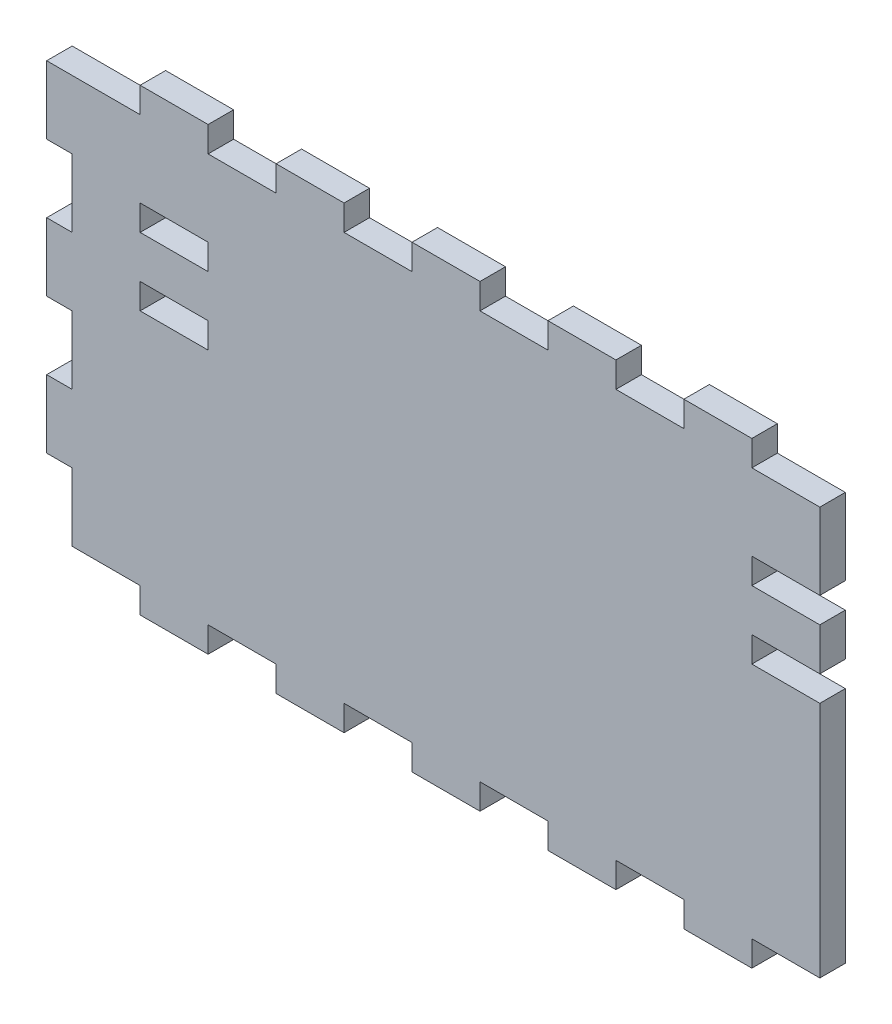
from build123d import *

# Parameters (mm, degrees)
SKETCH1_W               = 279.4
SKETCH1_H               = 152.4
BOSS_EXTRUDE1_DEPTH     = 9.525
SKETCH2_W               = 25.4
SKETCH2_H               = 9.525
BOSS_EXTRUDE2_DEPTH     = 9.525
LPATTERN1_COUNT         = 5
LPATTERN1_PITCH         = 50.8
MIRROR1_COPY_1_SKETCH_W = 25.4
MIRROR1_COPY_1_SKETCH_H = 9.525
MIRROR1_COPY_1_DEPTH    = 9.525
MIRROR1_COPY_2_SKETCH_W = 25.4
MIRROR1_COPY_2_SKETCH_H = 9.525
MIRROR1_COPY_2_DEPTH    = 9.525
MIRROR1_COPY_3_SKETCH_W = 25.4
MIRROR1_COPY_3_SKETCH_H = 9.525
MIRROR1_COPY_3_DEPTH    = 9.525
MIRROR1_COPY_4_SKETCH_W = 25.4
MIRROR1_COPY_4_SKETCH_H = 9.525
MIRROR1_COPY_4_DEPTH    = 9.525
MIRROR1_COPY_5_SKETCH_W = 25.4
MIRROR1_COPY_5_SKETCH_H = 9.525
MIRROR1_COPY_5_DEPTH    = 9.525
SKETCH3_W               = 9.525
SKETCH3_H               = 25.4
BOSS_EXTRUDE3_DEPTH     = 9.525
LPATTERN2_COUNT         = 3
LPATTERN2_PITCH         = 50.8
SKETCH4_W               = 25.4
SKETCH4_H               = 9.525
CUT_EXTRUDE1_DEPTH      = 173.358933261
LPATTERN3_COUNT         = 2
LPATTERN3_PITCH         = 228.6
SKETCH5_W               = 25.4
SKETCH5_H               = 9.525
CUT_EXTRUDE2_DEPTH      = 173.358933261
LPATTERN4_COUNT         = 2
LPATTERN4_PITCH         = 228.6


with BuildPart() as part:
    # Sketch1 → Boss-Extrude1 (new body)
    with BuildSketch(Plane.XY):
        Rectangle(SKETCH1_W, SKETCH1_H)
    extrude(amount=BOSS_EXTRUDE1_DEPTH)

    # Sketch2 → Boss-Extrude2 (add)
    with BuildSketch(Plane.XZ.offset(76.2)):
        with Locations((-101.6, 4.7625)):
            Rectangle(SKETCH2_W, SKETCH2_H)
    boss_extrude2 = extrude(amount=BOSS_EXTRUDE2_DEPTH)

    # LPattern1: Boss-Extrude2 ×5
    with Locations(*[(i * LPATTERN1_PITCH, 0, 0) for i in range(1, LPATTERN1_COUNT)]):
        add(boss_extrude2)

    # Mirror1 copy 1 sketch → Mirror1 copy 1 (add)
    with BuildSketch(Plane(origin=(50.8, 76.2, 0), x_dir=(1, 0, 0), z_dir=(0, 1, 0))):
        with Locations((-101.6, -4.7625)):
            Rectangle(MIRROR1_COPY_1_SKETCH_W, MIRROR1_COPY_1_SKETCH_H)
    extrude(amount=MIRROR1_COPY_1_DEPTH)

    # Mirror1 copy 2 sketch → Mirror1 copy 2 (add)
    with BuildSketch(Plane(origin=(101.6, 76.2, 0), x_dir=(1, 0, 0), z_dir=(0, 1, 0))):
        with Locations((-101.6, -4.7625)):
            Rectangle(MIRROR1_COPY_2_SKETCH_W, MIRROR1_COPY_2_SKETCH_H)
    extrude(amount=MIRROR1_COPY_2_DEPTH)

    # Mirror1 copy 3 sketch → Mirror1 copy 3 (add)
    with BuildSketch(Plane(origin=(152.4, 76.2, 0), x_dir=(1, 0, 0), z_dir=(0, 1, 0))):
        with Locations((-101.6, -4.7625)):
            Rectangle(MIRROR1_COPY_3_SKETCH_W, MIRROR1_COPY_3_SKETCH_H)
    extrude(amount=MIRROR1_COPY_3_DEPTH)

    # Mirror1 copy 4 sketch → Mirror1 copy 4 (add)
    with BuildSketch(Plane(origin=(203.2, 76.2, 0), x_dir=(1, 0, 0), z_dir=(0, 1, 0))):
        with Locations((-101.6, -4.7625)):
            Rectangle(MIRROR1_COPY_4_SKETCH_W, MIRROR1_COPY_4_SKETCH_H)
    extrude(amount=MIRROR1_COPY_4_DEPTH)

    # Mirror1 copy 5 sketch → Mirror1 copy 5 (add)
    with BuildSketch(Plane(origin=(0, 76.2, 0), x_dir=(1, 0, 0), z_dir=(0, 1, 0))):
        with Locations((-101.6, -4.7625)):
            Rectangle(MIRROR1_COPY_5_SKETCH_W, MIRROR1_COPY_5_SKETCH_H)
    extrude(amount=MIRROR1_COPY_5_DEPTH)

    # Sketch3 → Boss-Extrude3 (add)
    with BuildSketch(Plane.ZY.offset(139.7)):
        with Locations((4.7625, 63.5)):
            Rectangle(SKETCH3_W, SKETCH3_H)
    boss_extrude3 = extrude(amount=BOSS_EXTRUDE3_DEPTH)

    # LPattern2: Boss-Extrude3 ×3
    with Locations(*[(0, -i * LPATTERN2_PITCH, 0) for i in range(1, LPATTERN2_COUNT)]):
        add(boss_extrude3)

    # Sketch4 → Cut-Extrude1 (cut, through all)
    with BuildSketch(Plane(origin=(0, 0, 0), x_dir=(-1, 0, 0), z_dir=(0, 0, -1))):
        with Locations((-127, 17.4625)):
            Rectangle(SKETCH4_W, SKETCH4_H)
    cut_extrude1 = extrude(amount=-CUT_EXTRUDE1_DEPTH, mode=Mode.SUBTRACT)

    # LPattern3: Cut-Extrude1 ×2
    with Locations(*[(-i * LPATTERN3_PITCH, 0, 0) for i in range(1, LPATTERN3_COUNT)]):
        add(cut_extrude1, mode=Mode.SUBTRACT)

    # Sketch5 → Cut-Extrude2 (cut, through all)
    with BuildSketch(Plane.XY.offset(9.525)):
        with Locations((-101.6, 42.8625)):
            Rectangle(SKETCH5_W, SKETCH5_H)
    cut_extrude2 = extrude(amount=-CUT_EXTRUDE2_DEPTH, mode=Mode.SUBTRACT)

    # LPattern4: Cut-Extrude2 ×2
    with Locations(*[(i * LPATTERN4_PITCH, 0, 0) for i in range(1, LPATTERN4_COUNT)]):
        add(cut_extrude2, mode=Mode.SUBTRACT)


solid = part.part
